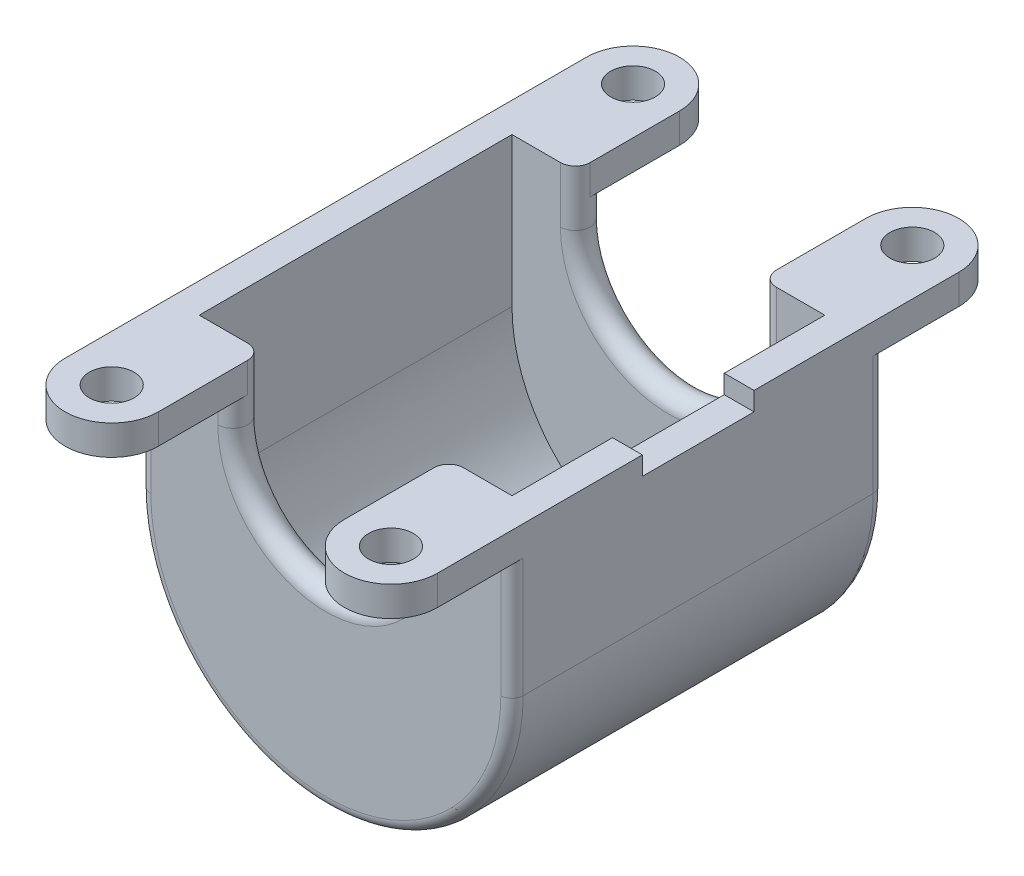
from build123d import *

# Parameters (mm, degrees)
BASE_DEPTH              = 8
CROQUIS5_R              = 6
PERFORACIONES_DEPTH     = 8
SALIENTE_EXTRUIR5_DEPTH = 100
VACIADO2_START          = -112
VACIADO2_DEPTH          = 84
CORTAR_EXTRUIR3_DEPTH   = 100
CROQUIS10_W             = 8
CROQUIS10_H             = 30
CORTAR_EXTRUIR4_DEPTH   = 5
REDONDEO1_R             = 4
REDONDEO2_R             = 4
REDONDEO3_R             = 3


# Read off the part's stored shape, not the designer's step: Vaciado2
with BuildPart() as part:
    # Croquis4 → Base (new body)
    with BuildSketch(Plane(origin=(0, 0, 0), x_dir=(1, 0, 0), z_dir=(0, 1, 0))):
        with BuildLine():
            Line((0, 0), (0, 140))
            ThreePointArc((0, 140), (-12.5, 152.5), (-25, 140))
            Line((-25, 140), (-25, 120))
            Line((-25, 120), (-75, 120))
            Line((-75, 120), (-75, 140))
            ThreePointArc((-75, 140), (-87.5, 152.5), (-100, 140))
            Line((-100, 140), (-100, 0))
            ThreePointArc((-100, 0), (-87.5, -12.5), (-75, 0))
            Line((-75, 0), (-75, 20))
            Line((-75, 20), (-25, 20))
            Line((-25, 20), (-25, 0))
            ThreePointArc((-25, 0), (-12.5, -12.5), (0, 0))
        make_face()
    extrude(amount=BASE_DEPTH)

    # Croquis5 → Perforaciones (cut)
    with BuildSketch(Plane.XZ):
        with Locations(Location((-87.5, 0, 0), (0, 0, 270))):
            Circle(CROQUIS5_R)
        with Locations(Location((-12.5, 0, 0), (0, 0, 270))):
            Circle(CROQUIS5_R)
        with Locations(Location((-87.5, -140, 0), (0, 0, 270))):
            Circle(CROQUIS5_R)
        with Locations(Location((-12.5, -140, 0), (0, 0, 270))):
            Circle(CROQUIS5_R)
    extrude(amount=-PERFORACIONES_DEPTH, mode=Mode.SUBTRACT)

    # Croquis7 → Saliente-Extruir5 (add)
    with BuildSketch(Plane.XY.offset(-20)):
        with BuildLine():
            Line((-100, 0), (-100, -32))
            ThreePointArc((-100, -32), (-50, -82), (0, -32))
            Line((0, -32), (0, 0))
            Line((0, 0), (-100, 0))
        make_face()
    extrude(amount=-SALIENTE_EXTRUIR5_DEPTH)

    # Vaciado2 outline → Vaciado2 (cut)
    with BuildSketch(Plane.XY.offset(VACIADO2_START)):
        with BuildLine():
            Line((-8, -32), (-8, 8))
            Line((-8, 8), (-92, 8))
            Line((-92, 8), (-92, -32))
            ThreePointArc((-92, -32), (-50, -74), (-8, -32))
        make_face()
    extrude(amount=VACIADO2_DEPTH, mode=Mode.SUBTRACT)

    # Croquis9 → Cortar-Extruir3 (cut)
    with BuildSketch(Plane.XY.offset(-20)):
        with BuildLine():
            Line((-75, 8), (-75, -7))
            ThreePointArc((-75, -7), (-50, -32), (-25, -7))
            Line((-25, -7), (-25, 8))
            Line((-25, 8), (-75, 8))
        make_face()
    extrude(amount=-CORTAR_EXTRUIR3_DEPTH, mode=Mode.SUBTRACT)

    # Croquis10 → Cortar-Extruir4 (cut)
    with BuildSketch(Plane(origin=(0, 8, 0), x_dir=(1, 0, 0), z_dir=(0, 1, 0))):
        with Locations((-4, 70)):
            Rectangle(CROQUIS10_W, CROQUIS10_H)
    extrude(amount=-CORTAR_EXTRUIR4_DEPTH, mode=Mode.SUBTRACT)

    # Redondeo1
    redondeo1_edges = [part.edges().sort_by_distance(p)[0] for p in [
        (-75, 0.5, -28),
        (-50, -32, -28),
        (-25, 0.5, -28),
        (-75, -3.5, -20),
        (-25, -3.5, -20),
    ]]
    fillet(redondeo1_edges, radius=REDONDEO1_R - 0.0001)  # a hair under: the kernel refuses the full size

    # Redondeo2
    redondeo2_edges = [part.edges().sort_by_distance(p)[0] for p in [
        (-25, 0.5, -112),
        (-25, -3.5, -120),
        (-50, -32, -112),
        (-75, 0.5, -112),
        (-75, -3.5, -120),
    ]]
    fillet(redondeo2_edges, radius=REDONDEO2_R - 0.0001)  # a hair under: the kernel refuses the full size

    # Redondeo3
    redondeo3_edges = [part.edges().sort_by_distance(p)[0] for p in [
        (0, -16, -120),
        (-50, -82, -120),
        (-100, -16, -120),
        (-100, -16, -20),
        (-50, -82, -20),
        (0, -16, -20),
    ]]
    fillet(redondeo3_edges, radius=REDONDEO3_R)


solid = part.part
